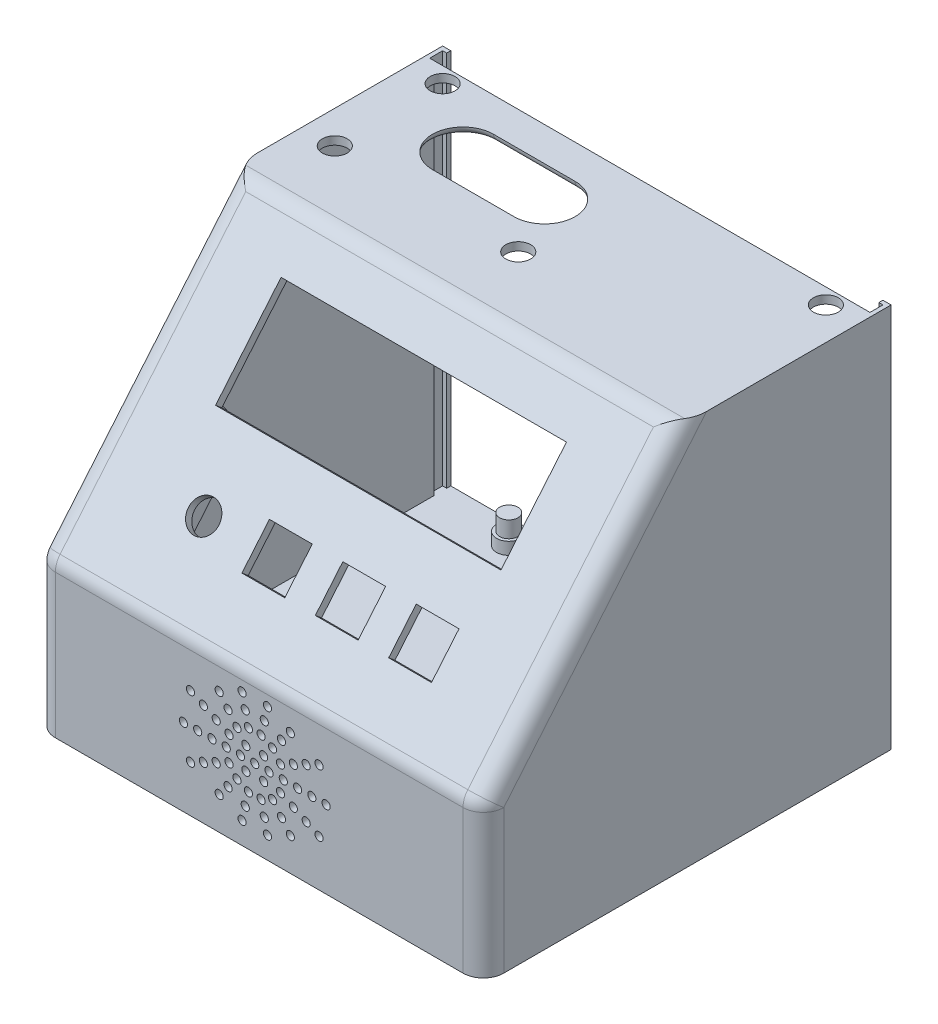
from build123d import *

# Parameters (mm, degrees)
BOSS_EXTRUDE1_DEPTH = 55
SHELL1_T            = -2
CUT_EXTRUDE1_REACH  = 154.538
SKETCH2_R           = 3.75
SKETCH2_W           = 70
SKETCH2_H           = 25
SKETCH2_W_2         = 10.5
SKETCH2_H_2         = 10.5
SKETCH3_R           = 1
CUT_EXTRUDE2_DEPTH  = 2
CUT_EXTRUDE3_REACH  = 150.143
SKETCH4_R           = 3.05
CUT_EXTRUDE4_REACH  = 148.876
SKETCH5_R           = 3.05
SKETCH6_R           = 1.275
BOSS_EXTRUDE2_DEPTH = 10
SKETCH8_R           = 3
BOSS_EXTRUDE5_DEPTH = 3
SKETCH9_R           = 2.25
BOSS_EXTRUDE6_DEPTH = 4
SKETCH10_R          = 2.25
BOSS_EXTRUDE7_DEPTH = 4
FILLET1_R           = 5
CUT_EXTRUDE5_DEPTH  = 82.453333234
SKETCH13_W          = 1
SKETCH13_H          = 3.175
CUT_EXTRUDE6_DEPTH  = 10
FILLET3_R           = 2


with BuildPart() as part:
    # Sketch1 → Boss-Extrude1 (new, symmetric)
    with BuildSketch(Plane(origin=(0, 0, 0), x_dir=(0, 0, -1), z_dir=(1, 0, 0))):
        Polygon((0, 0), (0, 37), (48.209070726, 94.453333234), (100, 94.453333234), (100, 0), align=None)
    extrude(amount=BOSS_EXTRUDE1_DEPTH, both=True)

    # Shell1
    shell1_openings = [part.faces().sort_by_distance(p)[0] for p in [
        (0, 47.226666617, -100),
    ]]
    offset(amount=SHELL1_T, openings=shell1_openings, kind=Kind.INTERSECTION)

    # Sketch2 → Cut-Extrude1 (cut, up to next)
    with BuildSketch(Plane(origin=(0, 15.287508713, 18.218943431), x_dir=(1, 0, 0), z_dir=(0, 0.6427876096865434, 0.7660444431189747)), mode=Mode.PRIVATE) as cut_extrude1_sk1:
        with Locations(Location((-26.5, 48.411029079, 0), (0, 0, 270))):
            Circle(SKETCH2_R)
    cut_extrude1_tool1 = extrude(cut_extrude1_sk1.sketch, amount=-CUT_EXTRUDE1_REACH, mode=Mode.PRIVATE) & part.part
    # Sketch2 → Cut-Extrude1 (cut, up to next)
    with BuildSketch(Plane(origin=(0, 15.287508713, 18.218943431), x_dir=(1, 0, 0), z_dir=(0, 0.6427876096865434, 0.7660444431189747)), mode=Mode.PRIVATE) as cut_extrude1_sk2:
        with Locations((0, 78.661029079)):
            Rectangle(SKETCH2_W, SKETCH2_H)
    cut_extrude1_tool2 = extrude(cut_extrude1_sk2.sketch, amount=-CUT_EXTRUDE1_REACH, mode=Mode.PRIVATE) & part.part
    # Sketch2 → Cut-Extrude1 (cut, up to next)
    with BuildSketch(Plane(origin=(0, 15.287508713, 18.218943431), x_dir=(1, 0, 0), z_dir=(0, 0.6427876096865434, 0.7660444431189747)), mode=Mode.PRIVATE) as cut_extrude1_sk3:
        with Locations((-8.5, 48.411029079)):
            Rectangle(SKETCH2_W_2, SKETCH2_H_2)
    cut_extrude1_tool3 = extrude(cut_extrude1_sk3.sketch, amount=-CUT_EXTRUDE1_REACH, mode=Mode.PRIVATE) & part.part
    # Sketch2 → Cut-Extrude1 (cut, up to next)
    with BuildSketch(Plane(origin=(0, 15.287508713, 18.218943431), x_dir=(1, 0, 0), z_dir=(0, 0.6427876096865434, 0.7660444431189747)), mode=Mode.PRIVATE) as cut_extrude1_sk4:
        with Locations((9.5, 48.411029079)):
            Rectangle(SKETCH2_W_2, SKETCH2_H_2)
    cut_extrude1_tool4 = extrude(cut_extrude1_sk4.sketch, amount=-CUT_EXTRUDE1_REACH, mode=Mode.PRIVATE) & part.part
    # Sketch2 → Cut-Extrude1 (cut, up to next)
    with BuildSketch(Plane(origin=(0, 15.287508713, 18.218943431), x_dir=(1, 0, 0), z_dir=(0, 0.6427876096865434, 0.7660444431189747)), mode=Mode.PRIVATE) as cut_extrude1_sk5:
        with Locations((27.5, 48.411029079)):
            Rectangle(SKETCH2_W_2, SKETCH2_H_2)
    cut_extrude1_tool5 = extrude(cut_extrude1_sk5.sketch, amount=-CUT_EXTRUDE1_REACH, mode=Mode.PRIVATE) & part.part
    add(cut_extrude1_tool1.solids().sort_by_distance((-26.5, 52.372509, -12.899066))[0], mode=Mode.SUBTRACT)
    add(cut_extrude1_tool2.solids().sort_by_distance((0, 75.545353, -32.343391))[0], mode=Mode.SUBTRACT)
    add(cut_extrude1_tool3.solids().sort_by_distance((-8.5, 52.372509, -12.899066))[0], mode=Mode.SUBTRACT)
    add(cut_extrude1_tool4.solids().sort_by_distance((9.5, 52.372509, -12.899066))[0], mode=Mode.SUBTRACT)
    add(cut_extrude1_tool5.solids().sort_by_distance((27.5, 52.372509, -12.899066))[0], mode=Mode.SUBTRACT)

    # Sketch3 → Cut-Extrude2 (cut)
    with BuildSketch(Plane.XY):
        with Locations((-4.58, 19)):
            Circle(SKETCH3_R)
        with Locations((-8.08, 19)):
            Circle(SKETCH3_R)
        with Locations((-11.58, 19)):
            Circle(SKETCH3_R)
        with Locations((-15.08, 19)):
            Circle(SKETCH3_R)
        with Locations((-18.58, 19)):
            Circle(SKETCH3_R)
        with Locations((-7.386782075, 22.037186174)):
            Circle(SKETCH3_R)
        with Locations((-10.540173113, 23.555779261)):
            Circle(SKETCH3_R)
        with Locations((-13.693564151, 25.074372348)):
            Circle(SKETCH3_R)
        with Locations((-16.846955188, 26.592965435)):
            Circle(SKETCH3_R)
        with Locations((-3.262214307, 21.736410189)):
            Circle(SKETCH3_R)
        with Locations((-5.444428613, 24.472820377)):
            Circle(SKETCH3_R)
        with Locations((-7.62664292, 27.209230566)):
            Circle(SKETCH3_R)
        with Locations((-9.808857226, 29.945640755)):
            Circle(SKETCH3_R)
        with Locations((-2.637646538, 25.824495385)):
            Circle(SKETCH3_R)
        with Locations((-3.416469807, 29.236743078)):
            Circle(SKETCH3_R)
        with Locations((-4.195293075, 32.648990771)):
            Circle(SKETCH3_R)
        with Locations((0.477646538, 25.824495385)):
            Circle(SKETCH3_R)
        with Locations((1.256469807, 29.236743078)):
            Circle(SKETCH3_R)
        with Locations((2.035293075, 32.648990771)):
            Circle(SKETCH3_R)
        with Locations((1.102214307, 21.736410189)):
            Circle(SKETCH3_R)
        with Locations((3.284428613, 24.472820377)):
            Circle(SKETCH3_R)
        with Locations((5.46664292, 27.209230566)):
            Circle(SKETCH3_R)
        with Locations((7.648857226, 29.945640755)):
            Circle(SKETCH3_R)
        with Locations((5.226782075, 22.037186174)):
            Circle(SKETCH3_R)
        with Locations((8.380173113, 23.555779261)):
            Circle(SKETCH3_R)
        with Locations((11.533564151, 25.074372348)):
            Circle(SKETCH3_R)
        with Locations((14.686955188, 26.592965435)):
            Circle(SKETCH3_R)
        with Locations((2.42, 19)):
            Circle(SKETCH3_R)
        with Locations((5.92, 19)):
            Circle(SKETCH3_R)
        with Locations((9.42, 19)):
            Circle(SKETCH3_R)
        with Locations((12.92, 19)):
            Circle(SKETCH3_R)
        with Locations((16.42, 19)):
            Circle(SKETCH3_R)
        with Locations((5.226782075, 15.962813826)):
            Circle(SKETCH3_R)
        with Locations((8.380173113, 14.444220739)):
            Circle(SKETCH3_R)
        with Locations((11.533564151, 12.925627652)):
            Circle(SKETCH3_R)
        with Locations((14.686955188, 11.407034565)):
            Circle(SKETCH3_R)
        with Locations((1.102214307, 16.263589811)):
            Circle(SKETCH3_R)
        with Locations((3.284428613, 13.527179623)):
            Circle(SKETCH3_R)
        with Locations((5.46664292, 10.790769434)):
            Circle(SKETCH3_R)
        with Locations((7.648857226, 8.054359245)):
            Circle(SKETCH3_R)
        with Locations((0.477646538, 12.175504615)):
            Circle(SKETCH3_R)
        with Locations((1.256469807, 8.763256922)):
            Circle(SKETCH3_R)
        with Locations((2.035293075, 5.351009229)):
            Circle(SKETCH3_R)
        with Locations((-2.637646538, 12.175504615)):
            Circle(SKETCH3_R)
        with Locations((-3.416469807, 8.763256922)):
            Circle(SKETCH3_R)
        with Locations((-4.195293075, 5.351009229)):
            Circle(SKETCH3_R)
        with Locations((-3.262214307, 16.263589811)):
            Circle(SKETCH3_R)
        with Locations((-5.444428613, 13.527179623)):
            Circle(SKETCH3_R)
        with Locations((-7.62664292, 10.790769434)):
            Circle(SKETCH3_R)
        with Locations((-9.808857226, 8.054359245)):
            Circle(SKETCH3_R)
        with Locations((-7.386782075, 15.962813826)):
            Circle(SKETCH3_R)
        with Locations((-10.540173113, 14.444220739)):
            Circle(SKETCH3_R)
        with Locations((-13.693564151, 12.925627652)):
            Circle(SKETCH3_R)
        with Locations((-16.846955188, 11.407034565)):
            Circle(SKETCH3_R)
        with Locations((-1.08, 19)):
            Circle(SKETCH3_R)
    extrude(amount=-CUT_EXTRUDE2_DEPTH, mode=Mode.SUBTRACT)

    # Sketch4 → Cut-Extrude3 (cut, up to next)
    with BuildSketch(Plane(origin=(0, 94.453333234, 0), x_dir=(1, 0, 0), z_dir=(0, 1, 0)), mode=Mode.PRIVATE) as cut_extrude3_sk1:
        with Locations(Location((47, 92, 0), (0, 0, 270))):
            Circle(SKETCH4_R)
    cut_extrude3_tool1 = extrude(cut_extrude3_sk1.sketch, amount=-CUT_EXTRUDE3_REACH, mode=Mode.PRIVATE) & part.part
    # Sketch4 → Cut-Extrude3 (cut, up to next)
    with BuildSketch(Plane(origin=(0, 94.453333234, 0), x_dir=(1, 0, 0), z_dir=(0, 1, 0)), mode=Mode.PRIVATE) as cut_extrude3_sk2:
        with Locations(Location((-2, 65.551743221, 0), (0, 0, 270))):
            Circle(SKETCH4_R)
    cut_extrude3_tool2 = extrude(cut_extrude3_sk2.sketch, amount=-CUT_EXTRUDE3_REACH, mode=Mode.PRIVATE) & part.part
    # Sketch4 → Cut-Extrude3 (cut, up to next)
    with BuildSketch(Plane(origin=(0, 94.453333234, 0), x_dir=(1, 0, 0), z_dir=(0, 1, 0)), mode=Mode.PRIVATE) as cut_extrude3_sk3:
        with Locations(Location((-47, 92, 0), (0, 0, 270))):
            Circle(SKETCH4_R)
    cut_extrude3_tool3 = extrude(cut_extrude3_sk3.sketch, amount=-CUT_EXTRUDE3_REACH, mode=Mode.PRIVATE) & part.part
    # Sketch4 → Cut-Extrude3 (cut, up to next)
    with BuildSketch(Plane(origin=(0, 94.453333234, 0), x_dir=(1, 0, 0), z_dir=(0, 1, 0)), mode=Mode.PRIVATE) as cut_extrude3_sk4:
        with Locations(Location((-47, 65.551743221, 0), (0, 0, 270))):
            Circle(SKETCH4_R)
    cut_extrude3_tool4 = extrude(cut_extrude3_sk4.sketch, amount=-CUT_EXTRUDE3_REACH, mode=Mode.PRIVATE) & part.part
    # Sketch4 → Cut-Extrude3 (cut, up to next)
    with BuildSketch(Plane(origin=(0, 94.453333234, 0), x_dir=(1, 0, 0), z_dir=(0, 1, 0)), mode=Mode.PRIVATE) as cut_extrude3_sk5:
        with BuildLine():
            Line((-30, 87.5), (-10, 87.5))
            ThreePointArc((-10, 87.5), (-2.5, 80), (-10, 72.5))
            Line((-10, 72.5), (-30, 72.5))
            ThreePointArc((-30, 72.5), (-37.5, 80), (-30, 87.5))
        make_face()
    cut_extrude3_tool5 = extrude(cut_extrude3_sk5.sketch, amount=-CUT_EXTRUDE3_REACH, mode=Mode.PRIVATE) & part.part
    add(cut_extrude3_tool1.solids().sort_by_distance((47, 94.453333, -92))[0], mode=Mode.SUBTRACT)
    add(cut_extrude3_tool2.solids().sort_by_distance((-2, 94.453333, -65.551743))[0], mode=Mode.SUBTRACT)
    add(cut_extrude3_tool3.solids().sort_by_distance((-47, 94.453333, -92))[0], mode=Mode.SUBTRACT)
    add(cut_extrude3_tool4.solids().sort_by_distance((-47, 94.453333, -65.551743))[0], mode=Mode.SUBTRACT)
    add(cut_extrude3_tool5.solids().sort_by_distance((-20, 94.453333, -80))[0], mode=Mode.SUBTRACT)

    # Sketch5 → Cut-Extrude4 (cut, up to next)
    with BuildSketch(Plane(origin=(0, 2, 0), x_dir=(1, 0, 0), z_dir=(0, 1, 0)), mode=Mode.PRIVATE) as cut_extrude4_sk1:
        with Locations(Location((46.5, 91.5, 0), (0, 0, 270))):
            Circle(SKETCH5_R)
    cut_extrude4_tool1 = extrude(cut_extrude4_sk1.sketch, amount=-CUT_EXTRUDE4_REACH, mode=Mode.PRIVATE) & part.part
    # Sketch5 → Cut-Extrude4 (cut, up to next)
    with BuildSketch(Plane(origin=(0, 2, 0), x_dir=(1, 0, 0), z_dir=(0, 1, 0)), mode=Mode.PRIVATE) as cut_extrude4_sk2:
        with Locations(Location((46.5, 8.5, 0), (0, 0, 270))):
            Circle(SKETCH5_R)
    cut_extrude4_tool2 = extrude(cut_extrude4_sk2.sketch, amount=-CUT_EXTRUDE4_REACH, mode=Mode.PRIVATE) & part.part
    # Sketch5 → Cut-Extrude4 (cut, up to next)
    with BuildSketch(Plane(origin=(0, 2, 0), x_dir=(1, 0, 0), z_dir=(0, 1, 0)), mode=Mode.PRIVATE) as cut_extrude4_sk3:
        with Locations(Location((-46.5, 8.5, 0), (0, 0, 270))):
            Circle(SKETCH5_R)
    cut_extrude4_tool3 = extrude(cut_extrude4_sk3.sketch, amount=-CUT_EXTRUDE4_REACH, mode=Mode.PRIVATE) & part.part
    add(cut_extrude4_tool1.solids().sort_by_distance((46.5, 2, -91.5))[0], mode=Mode.SUBTRACT)
    add(cut_extrude4_tool2.solids().sort_by_distance((46.5, 2, -8.5))[0], mode=Mode.SUBTRACT)
    add(cut_extrude4_tool3.solids().sort_by_distance((-46.5, 2, -8.5))[0], mode=Mode.SUBTRACT)

    # Sketch6 → Boss-Extrude2 (add)
    # profile 1 of 6: a face of its own
    with BuildSketch(Plane(origin=(0, 14.001933494, 16.686854544), x_dir=(-1, 0, 0), z_dir=(0, -0.6427876096865435, -0.7660444431189747))):
        with BuildLine():
            Line((-40.72, 55.411029079), (-40.72, 41.411029079))
            ThreePointArc((-40.72, 41.411029079), (-37.72, 38.411029079), (-34.72, 41.411029079))
            Line((-34.72, 41.411029079), (-34.72, 55.411029079))
            ThreePointArc((-34.72, 55.411029079), (-37.72, 58.411029079), (-40.72, 55.411029079))
        make_face()
        with Locations((-37.72, 41.411029079)):
            Circle(SKETCH6_R, mode=Mode.SUBTRACT)
        with Locations((-37.72, 55.411029079)):
            Circle(SKETCH6_R, mode=Mode.SUBTRACT)
    # profile 2 of 6: a face of its own
    with BuildSketch(Plane(origin=(0, 14.001933494, 16.686854544), x_dir=(-1, 0, 0), z_dir=(0, -0.6427876096865435, -0.7660444431189747))):
        with Locations((-37.72, 55.411029079)):
            Circle(SKETCH6_R)
    # profile 3 of 6: a face of its own
    with BuildSketch(Plane(origin=(0, 14.001933494, 16.686854544), x_dir=(-1, 0, 0), z_dir=(0, -0.6427876096865435, -0.7660444431189747))):
        with Locations((-37.72, 41.411029079)):
            Circle(SKETCH6_R)
    # profile 4 of 6: a face of its own
    with BuildSketch(Plane(origin=(0, 14.001933494, 16.686854544), x_dir=(-1, 0, 0), z_dir=(0, -0.6427876096865435, -0.7660444431189747))):
        with BuildLine():
            Line((35.28, 55.411029079), (35.28, 41.411029079))
            ThreePointArc((35.28, 41.411029079), (38.28, 38.411029079), (41.28, 41.411029079))
            Line((41.28, 41.411029079), (41.28, 55.411029079))
            ThreePointArc((41.28, 55.411029079), (38.28, 58.411029079), (35.28, 55.411029079))
        make_face()
        with Locations((38.28, 41.411029079)):
            Circle(SKETCH6_R, mode=Mode.SUBTRACT)
        with Locations((38.28, 55.411029079)):
            Circle(SKETCH6_R, mode=Mode.SUBTRACT)
    # profile 5 of 6: a face of its own
    with BuildSketch(Plane(origin=(0, 14.001933494, 16.686854544), x_dir=(-1, 0, 0), z_dir=(0, -0.6427876096865435, -0.7660444431189747))):
        with Locations((38.28, 41.411029079)):
            Circle(SKETCH6_R)
    # profile 6 of 6: a face of its own
    with BuildSketch(Plane(origin=(0, 14.001933494, 16.686854544), x_dir=(-1, 0, 0), z_dir=(0, -0.6427876096865435, -0.7660444431189747))):
        with Locations((38.28, 55.411029079)):
            Circle(SKETCH6_R)
    extrude(amount=BOSS_EXTRUDE2_DEPTH)

    # Sketch8 → Boss-Extrude5 (add)
    with BuildSketch(Plane(origin=(0, 2, 0), x_dir=(1, 0, 0), z_dir=(0, 1, 0))):
        with Locations(Location((32.75, 94.477632813, 0), (0, 0, 270))):
            Circle(SKETCH8_R)
        with Locations(Location((32.75, 33.477632813, 0), (0, 0, 270))):
            Circle(SKETCH8_R)
        with Locations(Location((-33.25, 33.477632813, 0), (0, 0, 270))):
            Circle(SKETCH8_R)
        with Locations(Location((-33.25, 94.477632813, 0), (0, 0, 270))):
            Circle(SKETCH8_R)
    extrude(amount=BOSS_EXTRUDE5_DEPTH)

    # Sketch9 → Boss-Extrude6 (add)
    with BuildSketch(Plane(origin=(0, 5, 0), x_dir=(1, 0, 0), z_dir=(0, 1, 0))):
        with Locations(Location((32.75, 94.477632813, 0), (0, 0, 270))):
            Circle(SKETCH9_R)
        with Locations(Location((32.75, 33.477632813, 0), (0, 0, 270))):
            Circle(SKETCH9_R)
        with Locations(Location((-33.25, 33.477632813, 0), (0, 0, 270))):
            Circle(SKETCH9_R)
        with Locations(Location((-33.25, 94.477632813, 0), (0, 0, 270))):
            Circle(SKETCH9_R)
    extrude(amount=BOSS_EXTRUDE6_DEPTH)

    # Sketch10 → Boss-Extrude7 (add)
    with BuildSketch(Plane(origin=(0, 14.001933494, 16.686854544), x_dir=(-1, 0, 0), z_dir=(0, -0.6427876096865435, -0.7660444431189747))):
        with Locations(Location((-37.29, 94.851029079, 0), (0, 0, 90))):
            Circle(SKETCH10_R)
        with Locations(Location((37.71, 94.851029079, 0), (0, 0, 90))):
            Circle(SKETCH10_R)
        with Locations(Location((-37.29, 63.851029079, 0), (0, 0, 90))):
            Circle(SKETCH10_R)
        with Locations(Location((37.71, 63.851029079, 0), (0, 0, 90))):
            Circle(SKETCH10_R)
    extrude(amount=BOSS_EXTRUDE7_DEPTH)

    # Fillet1
    fillet1_edges = [part.edges().sort_by_distance(p)[0] for p in [
        (55, 65.726666617, -24.104535363),
        (55, 18.5, 0),
        (-55, 18.5, 0),
        (-55, 65.726666617, -24.104535363),
        (0, 37, 0),
        (0, 94.453333234, -48.209070726),
    ]]
    fillet(fillet1_edges, radius=FILLET1_R)

    # Sketch12 → Cut-Extrude5 (cut)
    with BuildSketch(Plane(origin=(0, 94.453333234, 0), x_dir=(1, 0, 0), z_dir=(0, 1, 0))):
        Polygon((54, 95.825), (-54, 95.825), (-54, 99), (-53, 99), (-53, 100), (53, 100), (52.997982925, 99), (54, 99), align=None)
    extrude(amount=-CUT_EXTRUDE5_DEPTH, mode=Mode.SUBTRACT)

    # Sketch13 → Cut-Extrude6 (cut)
    with BuildSketch(Plane(origin=(0, 12, 0), x_dir=(1, 0, 0), z_dir=(0, 1, 0))):
        with Locations((53.5, 97.4125)):
            Rectangle(SKETCH13_W, SKETCH13_H)
        with Locations((-53.5, 97.4125)):
            Rectangle(SKETCH13_W, SKETCH13_H)
    extrude(amount=-CUT_EXTRUDE6_DEPTH, mode=Mode.SUBTRACT)

    # Fillet3
    fillet3_edges = [part.edges().sort_by_distance(p)[0] for p in [
        (-37.5, 92.453333234, -80),
        (-20, 92.453333234, -87.5),
        (-2.5, 92.453333234, -80),
        (-20, 92.453333234, -72.5),
    ]]
    fillet(fillet3_edges, radius=FILLET3_R - 0.0001)  # a hair under: the kernel refuses the full size


solid = part.part
